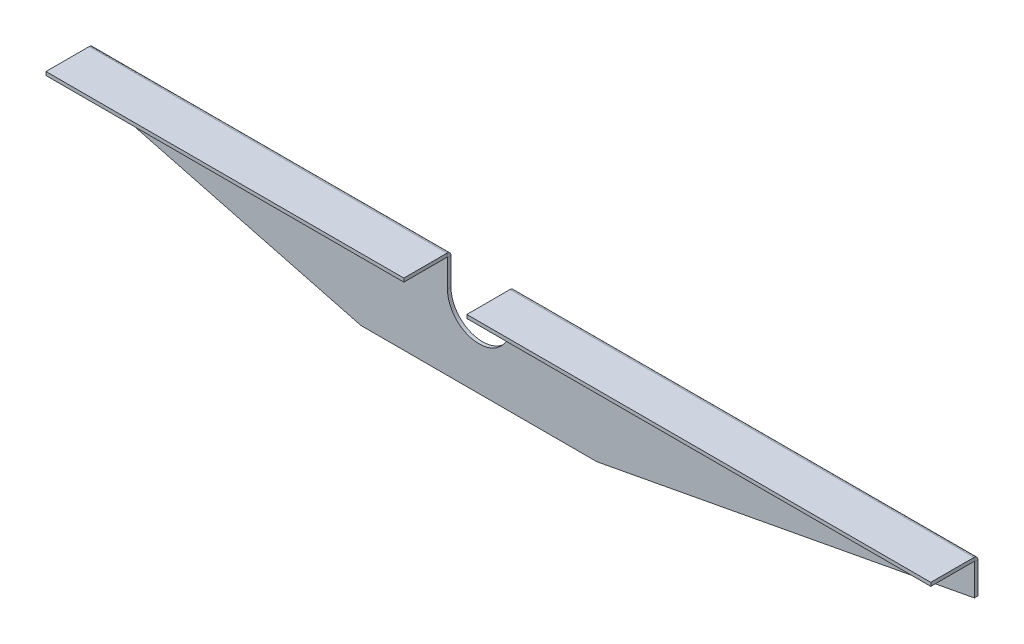
from build123d import *

# Parameters (mm, degrees)
BASE_FLANGE1_DEPTH             = 1.5
EDGE_FLANGE1_STRIP_W           = 6.4
EDGE_FLANGE1_STRIP_H           = 1.5
EDGE_FLANGE1_STRIP_CUT_DEPTH   = 151.65
EDGE_FLANGE1_STRIP_2_W         = 6.4
EDGE_FLANGE1_STRIP_2_H         = 1.5
EDGE_FLANGE1_STRIP_CUT_2_DEPTH = 196.65
EDGE_FLANGE1_DEPTH             = 151.65
EDGE_FLANGE1_BEND_DEPTH        = 196.65


# Sheet-metal steps are written as plain solids
with BuildPart() as part:
    # Sketch1 → Base-Flange1 (new body)
    with BuildSketch(Plane.XY):
        with BuildLine():
            Line((13.35, 0), (13.35, 13.35))
            Line((13.35, 13.35), (210, 13.35))
            Line((210, 13.35), (210, -1.65))
            Line((210, -1.65), (50, -31.65))
            Line((50, -31.65), (-50, -31.65))
            Line((-50, -31.65), (-165, -1.65))
            Line((-165, -1.65), (-165, 13.35))
            Line((-165, 13.35), (-13.35, 13.35))
            Line((-13.35, 13.35), (-13.35, 0))
            ThreePointArc((-13.35, 0), (0, -13.35), (13.35, 0))
        make_face()
    extrude(amount=-BASE_FLANGE1_DEPTH)

    # Edge-Flange1 strip (across the edge) → Edge-Flange1 strip cut (cut)
    with BuildSketch(Plane(origin=(-13.35, 13.35, 0), x_dir=(0, -1, 0), z_dir=(-1, 0, 0))):
        with Locations((-1.5, -0.75)):
            Rectangle(EDGE_FLANGE1_STRIP_W, EDGE_FLANGE1_STRIP_H)
    extrude(amount=EDGE_FLANGE1_STRIP_CUT_DEPTH, mode=Mode.SUBTRACT)

    # Edge-Flange1 strip 2 (across the edge) → Edge-Flange1 strip cut 2 (cut)
    with BuildSketch(Plane(origin=(210, 13.35, 0), x_dir=(0, -1, 0), z_dir=(-1, 0, 0))):
        with Locations((-1.5, -0.75)):
            Rectangle(EDGE_FLANGE1_STRIP_2_W, EDGE_FLANGE1_STRIP_2_H)
    extrude(amount=EDGE_FLANGE1_STRIP_CUT_2_DEPTH, mode=Mode.SUBTRACT)

    # Edge-Flange1 section (across the edge) → Edge-Flange1 (add)
    with BuildSketch(Plane(origin=(-13.35, 13.35, 0), x_dir=(0, -1, 0), z_dir=(-1, 0, 0))):
        with BuildLine():
            Line((0, 0.2), (0, 18.5))
            Line((0, 18.5), (1.5, 18.5))
            Line((1.5, 18.5), (1.5, 0.2))
            ThreePointArc((1.5, 0.2), (1.558578644, 0.058578644), (1.7, 0))
            Line((1.7, 0), (1.7, -1.5))
            ThreePointArc((1.7, -1.5), (0.497918472, -1.002081528), (0, 0.2))
        make_face()
    extrude(amount=EDGE_FLANGE1_DEPTH)

    # Edge-Flange1 section 2 (across the edge) → Edge-Flange1 bend (add)
    with BuildSketch(Plane(origin=(210, 13.35, 0), x_dir=(0, -1, 0), z_dir=(-1, 0, 0))):
        with BuildLine():
            Line((0, 0.2), (0, 18.5))
            Line((0, 18.5), (1.5, 18.5))
            Line((1.5, 18.5), (1.5, 0.2))
            ThreePointArc((1.5, 0.2), (1.558578644, 0.058578644), (1.7, 0))
            Line((1.7, 0), (1.7, -1.5))
            ThreePointArc((1.7, -1.5), (0.497918472, -1.002081528), (0, 0.2))
        make_face()
    extrude(amount=EDGE_FLANGE1_BEND_DEPTH)


solid = part.part
